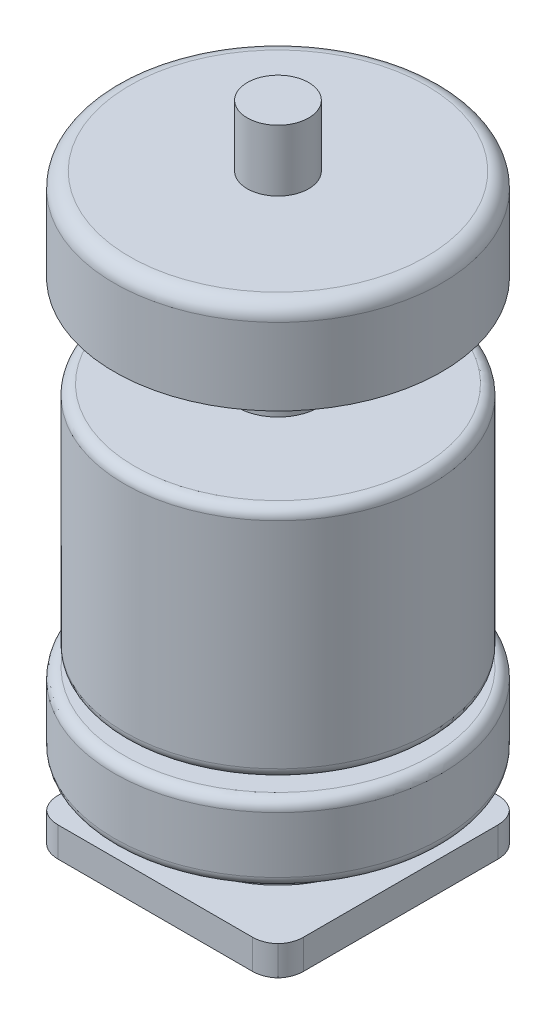
from build123d import *

# Parameters (mm, degrees)
SKIZZE1_W                       = 16
SKIZZE1_H                       = 63
SKIZZE6_W                       = 14.056140901
SKIZZE6_H                       = 6
SCHNITT_LINEAR_AUSTRAGEN2_DEPTH = 2.9
SKIZZE8_W                       = 9.697943534
SKIZZE8_H                       = 4.605462576
VERRUNDUNG1_R                   = 2.7
SKIZZE9_W                       = 13.512274764
SKIZZE9_H                       = 9
SKIZZE11_W                      = 2.793838278
SKIZZE11_H                      = 24.477994545
SKIZZE12_W                      = 8.586499361
SKIZZE12_H                      = 1
VERRUNDUNG2_R                   = 1.5
VERRUNDUNG3_R                   = 1
VERRUNDUNG4_R                   = 1


with BuildPart() as part:
    # Skizze1 → Rotation1 (revolve)
    with BuildSketch(Plane(origin=(0, 0, 0), x_dir=(0, 0, -1), z_dir=(1, 0, 0))):
        with Locations((-18, -0.15056419)):
            Rectangle(SKIZZE1_W, SKIZZE1_H)
    revolve(axis=Axis((0, 31.34943581, 10), (0, -1, 0)))

    # Skizze6 → Schnitt-Rotation1 (revolve, cut)
    with BuildSketch(Plane.XY.offset(10), mode=Mode.PRIVATE) as schnitt_rotation1_sk:
        with Locations((-10.028070451, 28.34943581)):
            Rectangle(SKIZZE6_W, SKIZZE6_H)
    revolve(schnitt_rotation1_sk.sketch.rotate(Axis((0, 55, 10), (0, -1, 0)), 270), axis=Axis((0, 55, 10), (0, -1, 0)), mode=Mode.SUBTRACT)

    # Skizze7 → Schnitt-Linear austragen2 (cut)
    with BuildSketch(Plane.XZ.offset(31.65056419)):
        with BuildLine():
            Line((-10.583005244, 22), (10.583005244, 22))
            ThreePointArc((10.583005244, 22), (0, 26), (-10.583005244, 22))
        make_face()
        with BuildLine():
            ThreePointArc((16, 10), (14.966629547, 15.656854249), (12, 20.583005244))
            Line((12, 20.583005244), (12, -0.583005244))
            ThreePointArc((12, -0.583005244), (14.966629547, 4.343145751), (16, 10))
        make_face()
        with BuildLine():
            ThreePointArc((-10.583005244, -2), (0, -6), (10.583005244, -2))
            Line((10.583005244, -2), (-10.583005244, -2))
        make_face()
        with BuildLine():
            Line((-12, -0.583005244), (-12, 20.583005244))
            ThreePointArc((-12, 20.583005244), (-16, 10), (-12, -0.583005244))
        make_face()
    extrude(amount=-SCHNITT_LINEAR_AUSTRAGEN2_DEPTH, mode=Mode.SUBTRACT)

    # Skizze8 → Schnitt-Rotation2 (revolve, cut)
    with BuildSketch(Plane.XY.offset(10), mode=Mode.PRIVATE) as schnitt_rotation2_sk:
        with Locations((-13.848971767, -26.447832902)):
            Rectangle(SKIZZE8_W, SKIZZE8_H)
    revolve(schnitt_rotation2_sk.sketch.rotate(Axis((0, 55, 10), (0, -1, 0)), 270), axis=Axis((0, 55, 10), (0, -1, 0)), mode=Mode.SUBTRACT)

    # Verrundung1
    # the kernel refuses this fillet: 2.7 mm, written as the material it takes off along each edge
    with BuildSketch(Plane(origin=(-12, -34.598571865, 20.583005244), x_dir=(0.6886261541674549, 0, 0.72511655600775), z_dir=(0, 1, 0)), Plane(origin=(-10.583005244, -34.598571865, -2), x_dir=(-0.7251165560077487, 0, 0.6886261541674565), z_dir=(0, 1, 0)), Plane(origin=(10.583005244, -34.598571865, 22), x_dir=(0.72511655600775, 0, -0.6886261541674551), z_dir=(0, 1, 0)), Plane(origin=(12, -34.598571865, -0.583005244), x_dir=(-0.6886261541674555, 0, -0.7251165560077496), z_dir=(0, 1, 0))) as verrundung1_piece_1:
        with BuildLine():
            CenterArc((1.079707811, 2.698166172), VERRUNDUNG1_R, 226.478544781, 45.633288329)
            Line((-0.779582805, 0.740351471), (0, 0))
            ThreePointArc((0, 0), (0.589601535, -0.010867127), (1.17920307, 0))
        make_face()
    extrude(amount=8.796015351, mode=Mode.SUBTRACT)
    with BuildSketch(Plane(origin=(-12, -34.598571865, -0.583005244), x_dir=(0, 0, 1), z_dir=(0, 1, 0)), Plane(origin=(10.583005244, -34.598571865, -2), x_dir=(-1, 0, 0), z_dir=(0, 1, 0)), Plane(origin=(12, -34.598571865, 20.583005244), x_dir=(0, 0, -1), z_dir=(0, 1, 0))) as verrundung1_piece_2:
        with BuildLine():
            CenterArc((1.075113785, 2.7), VERRUNDUNG1_R, 224.366711671, 45.633288329)
            ThreePointArc((-0.855059669, 0.812030075), (-0.435013222, 0.398135104), (0, 0))
            Line((0, 0), (1.075113785, 0))
        make_face()
    extrude(amount=8.796015351, mode=Mode.SUBTRACT)
    with BuildSketch(Plane(origin=(-10.583005244, -34.598571865, 22), x_dir=(-0.7251165560077509, 0, -0.6886261541674541), z_dir=(0, 1, 0))) as verrundung1_piece_3:
        with BuildLine():
            CenterArc((1.079707811, -2.698166172), VERRUNDUNG1_R, 87.88816689, 45.633288329)
            Line((-0.779582805, -0.740351471), (0, 0))
            ThreePointArc((0, 0), (0.589601535, 0.010867127), (1.17920307, 0))
        make_face()
    extrude(amount=8.796015351, mode=Mode.SUBTRACT)

    # Skizze9 → Schnitt-Rotation3 (revolve, cut)
    with BuildSketch(Plane.XY.offset(10), mode=Mode.PRIVATE) as schnitt_rotation3_sk:
        with Locations((10.756137382, 11.84943581)):
            Rectangle(SKIZZE9_W, SKIZZE9_H)
    revolve(schnitt_rotation3_sk.sketch.rotate(Axis((0, 55, 10), (0, -1, 0)), 90), axis=Axis((0, 55, 10), (0, -1, 0)), mode=Mode.SUBTRACT)

    # Skizze11 → Schnitt-Rotation4 (revolve, cut)
    with BuildSketch(Plane.XY.offset(10), mode=Mode.PRIVATE) as schnitt_rotation4_sk:
        with Locations((-16.396919139, -4.411566918)):
            Rectangle(SKIZZE11_W, SKIZZE11_H)
    revolve(schnitt_rotation4_sk.sketch.rotate(Axis((0, 55, 10), (0, -1, 0)), 270), axis=Axis((0, 55, 10), (0, -1, 0)), mode=Mode.SUBTRACT)

    # Skizze12 → Schnitt-Rotation5 (revolve, cut)
    with BuildSketch(Plane.XY.offset(10), mode=Mode.PRIVATE) as schnitt_rotation5_sk:
        with Locations((-13.293249681, -16.15056419)):
            Rectangle(SKIZZE12_W, SKIZZE12_H)
    revolve(schnitt_rotation5_sk.sketch.rotate(Axis((0, 55, 10), (0, -1, 0)), 270), axis=Axis((0, 55, 10), (0, -1, 0)), mode=Mode.SUBTRACT)

    # Verrundung2
    verrundung2_edges = [part.edges().sort_by_distance(p)[0] for p in [
        (0, 25.34943581, -6),
    ]]
    fillet(verrundung2_edges, radius=VERRUNDUNG2_R)

    # Verrundung3
    verrundung3_edges = [part.edges().sort_by_distance(p)[0] for p in [
        (0, -16.65056419, -6),
        (0, -24.145101614, -6),
    ]]
    fillet(verrundung3_edges, radius=VERRUNDUNG3_R)

    # Verrundung4
    verrundung4_edges = [part.edges().sort_by_distance(p)[0] for p in [
        (0, 7.34943581, -5),
        (0, -15.65056419, -5),
    ]]
    fillet(verrundung4_edges, radius=VERRUNDUNG4_R)


solid = part.part
